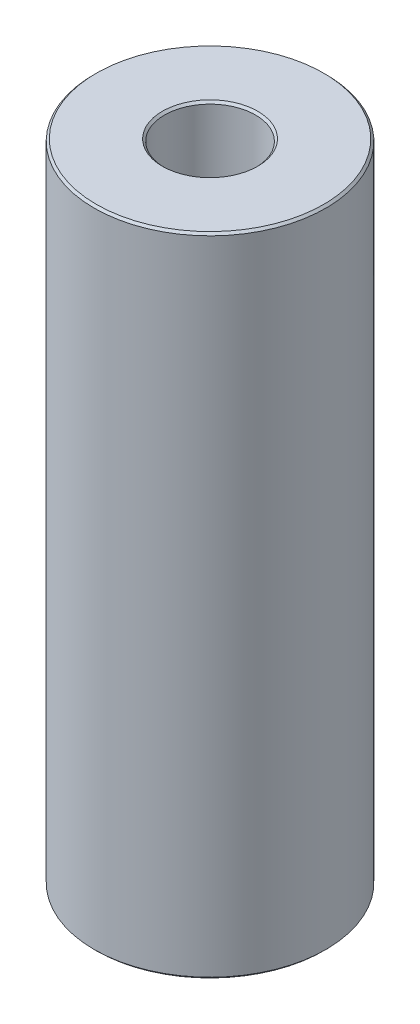
from build123d import *

# Parameters (mm, degrees)
SKETCH1_R           = 52.5
BOSS_EXTRUDE1_DEPTH = 292.911476982
SKETCH2_R           = 20.633087507
CUT_EXTRUDE1_DEPTH  = 303.174839038
CHAMFER1_SIZE       = 0.982913388


with BuildPart() as part:
    # Sketch1 → Boss-Extrude1 (new body)
    with BuildSketch(Plane(origin=(0, 0, 0), x_dir=(1, 0, 0), z_dir=(0, 1, 0))):
        Circle(SKETCH1_R)
    extrude(amount=BOSS_EXTRUDE1_DEPTH)

    # Sketch2 → Cut-Extrude1 (cut, through all)
    with BuildSketch(Plane(origin=(0, 0, 0), x_dir=(1, 0, 0), z_dir=(0, 1, 0))):
        Circle(SKETCH2_R)
    extrude(amount=CUT_EXTRUDE1_DEPTH, mode=Mode.SUBTRACT)

    # Chamfer1
    chamfer1_edges = [part.edges().sort_by_distance(p)[0] for p in [
        (-20.633087507, 292.911476982, 0),
        (-20.633087507, 0, 0),
        (-52.5, 0, 0),
        (-52.5, 292.911476982, 0),
    ]]
    chamfer(chamfer1_edges, length=CHAMFER1_SIZE)


solid = part.part
